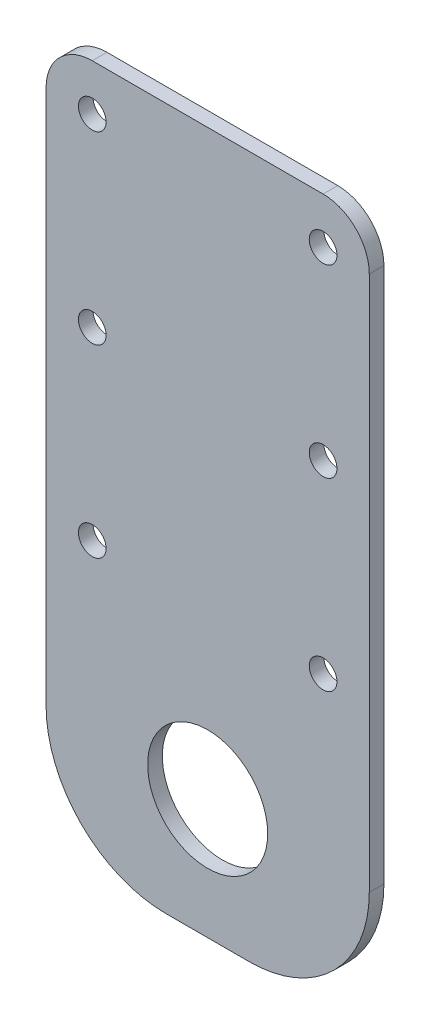
from build123d import *

# Parameters (mm, degrees)
SKETCH1_R           = 6.5
SKETCH1_R_2         = 1.5
BOSS_EXTRUDE1_DEPTH = 1.5875
FILLET1_R           = 5
FILLET2_R           = 13


with BuildPart() as part:
    # Sketch1 → Boss-Extrude1 (new body)
    with BuildSketch(Plane.XY):
        Polygon((0, 0), (0, 50), (35, 50), (35, 0), (35, -26), (0, -26), align=None)
        with Locations((17.5, -13)):
            Circle(SKETCH1_R, mode=Mode.SUBTRACT)
        with Locations((5, 45)):
            Circle(SKETCH1_R_2, mode=Mode.SUBTRACT)
        with Locations((5, 25)):
            Circle(SKETCH1_R_2, mode=Mode.SUBTRACT)
        with Locations((5, 5)):
            Circle(SKETCH1_R_2, mode=Mode.SUBTRACT)
        with Locations((30, 5)):
            Circle(SKETCH1_R_2, mode=Mode.SUBTRACT)
        with Locations((30, 25)):
            Circle(SKETCH1_R_2, mode=Mode.SUBTRACT)
        with Locations((30, 45)):
            Circle(SKETCH1_R_2, mode=Mode.SUBTRACT)
    extrude(amount=BOSS_EXTRUDE1_DEPTH)

    # Fillet1
    fillet1_edges = [part.edges().sort_by_distance(p)[0] for p in [
        (0, 50, 0.79375),
        (35, 50, 0.79375),
    ]]
    fillet(fillet1_edges, radius=FILLET1_R)

    # Fillet2
    fillet2_edges = [part.edges().sort_by_distance(p)[0] for p in [
        (35, -26, 0.79375),
        (0, -26, 0.79375),
    ]]
    fillet(fillet2_edges, radius=FILLET2_R)


solid = part.part
